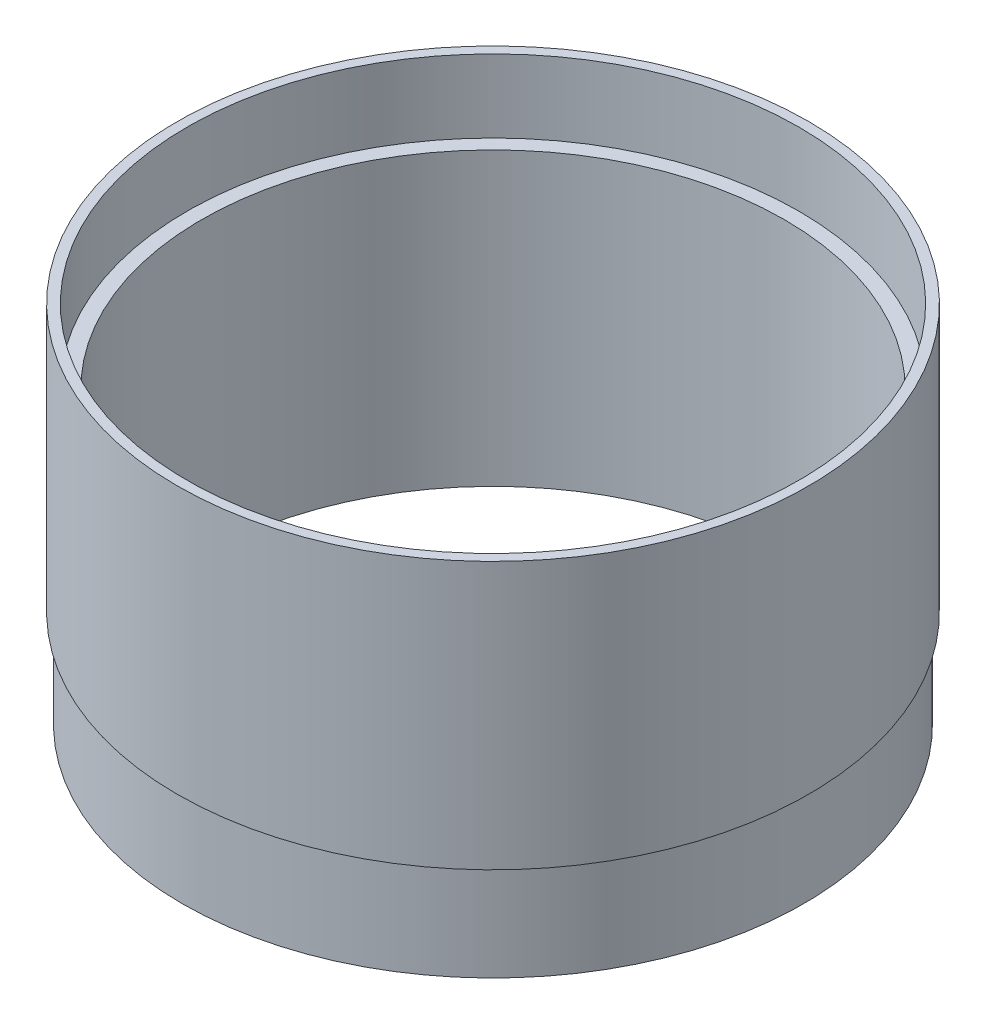
from build123d import *


with BuildPart() as part:
    # Szkic1 → Obrót1 (revolve)
    with BuildSketch(Plane.XY):
        Polygon((60, -30), (64, -30), (64, -10), (65, -10), (65, 45), (63, 45), (63, 30), (60, 30), align=None)
    revolve(axis=Axis((0, -40.039142771, 0), (0, 1, 0)))


solid = part.part
